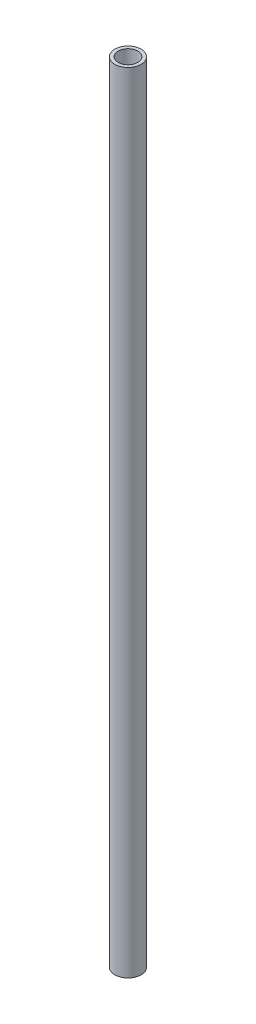
from build123d import *

# Parameters (mm, degrees)
SKETCH1_R           = 1
BOSS_EXTRUDE1_DEPTH = 60
SKETCH2_R           = 0.75
CUT_EXTRUDE1_DEPTH  = 60


with BuildPart() as part:
    # Sketch1 → Boss-Extrude1 (new body)
    with BuildSketch(Plane(origin=(0, 0, 0), x_dir=(1, 0, 0), z_dir=(0, 1, 0))):
        Circle(SKETCH1_R)
    extrude(amount=BOSS_EXTRUDE1_DEPTH)

    # Sketch2 → Cut-Extrude1 (cut)
    with BuildSketch(Plane.XZ):
        Circle(SKETCH2_R)
    extrude(amount=-CUT_EXTRUDE1_DEPTH, mode=Mode.SUBTRACT)


solid = part.part
